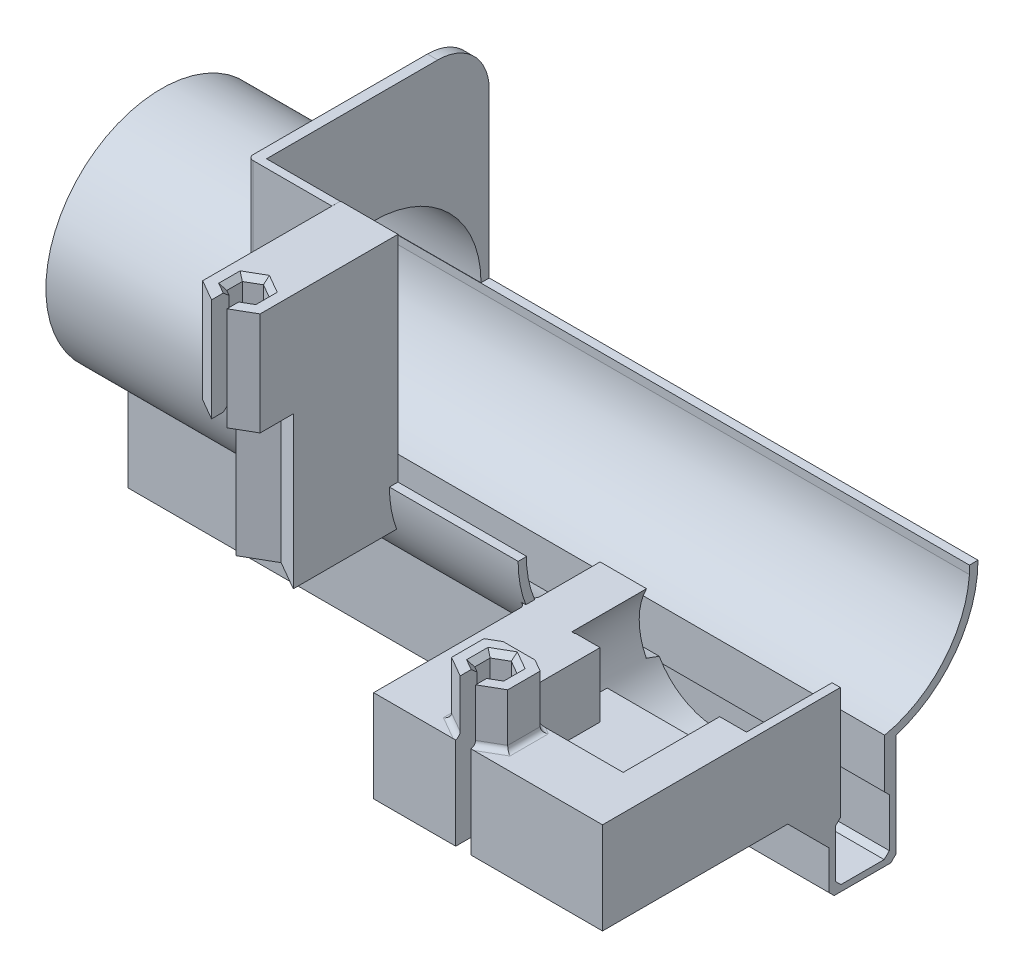
from build123d import *
from build123d.topology import SkipClean

# Parameters (mm, degrees)
SKETCH1_W            = 136
SKETCH1_H            = 13
BOSS_EXTRUDE1_DEPTH  = 21
CUT_EXTRUDE1_DEPTH   = 135
CHAMFER1_SIZE        = 1
CHAMFER2_SIZE        = 1
SKETCH6_W            = 135
SKETCH6_H            = 8.6
CUT_EXTRUDE3_DEPTH   = 9
SKETCH8_W            = 1.5
SKETCH8_H            = 7.54
CUT_EXTRUDE5_DEPTH   = 1
BOSS_EXTRUDE3_DEPTH  = 136
SKETCH11_R           = 22.4
SKETCH11_R_2         = 20.8
BOSS_EXTRUDE6_DEPTH  = 41.2
SKETCH6_5_W          = 135
SKETCH6_5_H          = 8.6
CUT_EXTRUDE11_DEPTH  = 35
SKETCH6_6_W          = 135
SKETCH6_6_H          = 8.6
CUT_EXTRUDE12_DEPTH  = 1
SKETCH13_W           = 47
SKETCH13_H           = 22
CUT_EXTRUDE13_DEPTH  = 32
BOSS_EXTRUDE7_DEPTH  = 22
BOSS_EXTRUDE8_DEPTH  = 4.79
BOSS_EXTRUDE10_DEPTH = 16.45
SKETCH18_R           = 13
CUT_EXTRUDE14_DEPTH  = 8
CUT_EXTRUDE15_START  = 8
SKETCH18_2_R         = 13
CUT_EXTRUDE15_DEPTH  = 8
SKETCH21_W           = 23.2
SKETCH21_H           = 25.13
CUT_EXTRUDE16_DEPTH  = 12.5
BOSS_EXTRUDE11_DEPTH = 1.39
SKETCH21_2_W         = 23.2
SKETCH21_2_H         = 25.13
CUT_EXTRUDE18_DEPTH  = 33.8
CUT_EXTRUDE20_DEPTH  = 12.5
SKETCH24_R           = 1.2
CUT_EXTRUDE21_DEPTH  = 12
CUT_EXTRUDE22_DEPTH  = 30
CUT_EXTRUDE23_START  = 8
SKETCH18_3_R         = 13
CUT_EXTRUDE23_DEPTH  = 8
CHAMFER3_SIZE        = 8
SKETCH26_W           = 12.499903438
SKETCH26_H           = 2.2
CUT_EXTRUDE24_DEPTH  = 8
CUT_EXTRUDE25_DEPTH  = 11
SKETCH28_W           = 1.6
SKETCH28_H           = 2.2
BOSS_EXTRUDE14_DEPTH = 12.5
CUT_EXTRUDE26_START  = -6.5
CUT_EXTRUDE26_DEPTH  = 6.5
FILLET2_R            = 1
FILLET3_R            = 1
BOSS_EXTRUDE15_DEPTH = 2.601750673
FILLET5_R            = 1
FILLET6_R            = 1
BOSS_EXTRUDE16_DEPTH = 20
BOSS_EXTRUDE17_DEPTH = 49.4
SKETCH36_W           = 11.15
SKETCH36_H           = 7.78
CUT_EXTRUDE27_DEPTH  = 20
BOSS_EXTRUDE18_START = -2
BOSS_EXTRUDE18_DEPTH = 2
FILLET10_R           = 10
SKETCH39_W           = 14.281750673
SKETCH39_H           = 1.6
BOSS_EXTRUDE19_DEPTH = 41.62
FILLET11_R           = 1
CUT_EXTRUDE28_DEPTH  = 25
CUT_EXTRUDE31_DEPTH  = 30
CHAMFER4_SIZE        = 1
CHAMFER5_SIZE        = 1


with BuildPart() as part:
    # Sketch1 → Boss-Extrude1 (new body)
    with BuildSketch(Plane(origin=(0, 0, 0), x_dir=(1, 0, 0), z_dir=(0, 1, 0))):
        with Locations((68, 6.5)):
            Rectangle(SKETCH1_W, SKETCH1_H)
    extrude(amount=BOSS_EXTRUDE1_DEPTH)

    # Sketch4 → Cut-Extrude1 (cut)
    with BuildSketch(Plane(origin=(136, 0, 0), x_dir=(0, 0, -1), z_dir=(1, 0, 0))):
        Polygon((1.3, 2.2), (2.3, 1.2), (10.7, 1.2), (11.7, 2.2), (11.7, 11.6), (10.7, 12.6), (2.3, 12.6), (1.3, 11.6), align=None)
    extrude(amount=-CUT_EXTRUDE1_DEPTH, mode=Mode.SUBTRACT)

    # Chamfer1
    chamfer1_edges = [part.edges().sort_by_distance(p)[0] for p in [
        (68, 0, 0),
    ]]
    chamfer(chamfer1_edges, length=CHAMFER1_SIZE)

    # Chamfer2
    chamfer2_edges = [part.edges().sort_by_distance(p)[0] for p in [
        (68, 0, -13),
    ]]
    chamfer(chamfer2_edges, length=CHAMFER2_SIZE)

    # Sketch6 → Cut-Extrude3 (cut)
    with BuildSketch(Plane(origin=(0, 21, 0), x_dir=(1, 0, 0), z_dir=(0, 1, 0))):
        with Locations((68.5, 6.5)):
            Rectangle(SKETCH6_W, SKETCH6_H)
    extrude(amount=-CUT_EXTRUDE3_DEPTH, mode=Mode.SUBTRACT)

    # Sketch8 → Cut-Extrude5 (cut)
    with BuildSketch(Plane.ZY):
        with Locations((-9.75, 16.23)):
            Rectangle(SKETCH8_W, SKETCH8_H)
        with Locations((-3.25, 16.23)):
            Rectangle(SKETCH8_W, SKETCH8_H)
    extrude(amount=-CUT_EXTRUDE5_DEPTH, mode=Mode.SUBTRACT)



with BuildPart() as body_2:
    # Sketch9 → Boss-Extrude3 (new body)
    with BuildSketch(Plane.ZY):
        with BuildLine():
            Line((-28.9, 42.4), (-27.238370235, 42.4))
            Line((-27.238370235, 42.4), (-27.238370235, 40.8))
            ThreePointArc((-27.238370235, 40.8), (-6.5, 21.6), (14.238370235, 40.8))
            Line((14.238370235, 40.8), (14.238370235, 42.4))
            Line((14.238370235, 42.4), (15.9, 42.4))
            ThreePointArc((15.9, 42.4), (-6.5, 20), (-28.9, 42.4))
        make_face()
    extrude(amount=-BOSS_EXTRUDE3_DEPTH)


with BuildPart() as part_1:
    add(part.part)

    add(body_2.part)  # Boss-Extrude6 merges body 2
    # Sketch11 → Boss-Extrude6 (add)
    with BuildSketch(Plane.ZY):
        with Locations((-6.5, 42.4)):
            Circle(SKETCH11_R)
        with Locations((-6.5, 42.4)):
            Circle(SKETCH11_R_2, mode=Mode.SUBTRACT)
    extrude(amount=-BOSS_EXTRUDE6_DEPTH)

    # Sketch6<5> → Cut-Extrude11 (cut)
    with BuildSketch(Plane(origin=(0, 21, 0), x_dir=(1, 0, 0), z_dir=(0, 1, 0))):
        with Locations((68.5, 6.5)):
            Rectangle(SKETCH6_5_W, SKETCH6_5_H)
    extrude(amount=CUT_EXTRUDE11_DEPTH, mode=Mode.SUBTRACT)

    # Sketch6<6> → Cut-Extrude12 (cut)
    with BuildSketch(Plane(origin=(0, 21, 0), x_dir=(1, 0, 0), z_dir=(0, 1, 0))):
        with Locations((68.5, 6.5)):
            Rectangle(SKETCH6_6_W, SKETCH6_6_H)
    extrude(amount=-CUT_EXTRUDE12_DEPTH, mode=Mode.SUBTRACT)

    # Sketch13 → Cut-Extrude13 (cut)
    with BuildSketch(Plane.XY):
        with Locations((112.5, 31.963815638)):
            Rectangle(SKETCH13_W, SKETCH13_H)
    extrude(amount=CUT_EXTRUDE13_DEPTH, mode=Mode.SUBTRACT)



with BuildPart() as body_2_2:
    # Sketch16 → Boss-Extrude7 (new body)
    with BuildSketch(Plane(origin=(0, 22.7, 0), x_dir=(1, 0, 0), z_dir=(0, 1, 0))):
        Polygon((109.021750673, -31.35), (103.574450883, -34.495), (103.574450883, -40.785), (109.021750673, -43.93), (114.469050463, -40.785), (114.469050463, -34.495), align=None)
        Polygon((109.021750673, -40.64), (111.619826884, -39.14), (111.619826884, -36.14), (109.021750673, -34.64), (106.423674461, -36.14), (106.423674461, -39.14), align=None, mode=Mode.SUBTRACT)
    extrude(amount=BOSS_EXTRUDE7_DEPTH)

    # Sketch16<2> → Boss-Extrude8 (add)
    with BuildSketch(Plane(origin=(0, 22.7, 0), x_dir=(1, 0, 0), z_dir=(0, 1, 0))):
        Polygon((109.021750673, -31.35), (103.574450883, -34.495), (103.574450883, -40.785), (109.021750673, -43.93), (114.469050463, -40.785), (114.469050463, -34.495), align=None)
        Polygon((109.021750673, -40.64), (111.619826884, -39.14), (111.619826884, -36.14), (109.021750673, -34.64), (106.423674461, -36.14), (106.423674461, -39.14), align=None, mode=Mode.SUBTRACT)
    extrude(amount=-BOSS_EXTRUDE8_DEPTH)


with BuildPart() as part_2:
    add(part_1.part)

    add(body_2_2.part)  # Boss-Extrude10 merges body 2 2
    # Sketch17 → Boss-Extrude10 (add)
    with BuildSketch(Plane.XZ.offset(-17.91)):
        Polygon((94.021750673, 43.93), (136, 43.93), (136, 0), (94.021750673, 0), (91.601750673, 0), (91.601750673, 43.93), align=None)
    extrude(amount=-BOSS_EXTRUDE10_DEPTH)

    # Sketch18 → Cut-Extrude14 (cut)
    with BuildSketch(Plane.XY):
        with Locations((112.185002614, 28.45)):
            Circle(SKETCH18_R)
    extrude(amount=-CUT_EXTRUDE14_DEPTH, mode=Mode.SUBTRACT)

    # Sketch18<2> → Cut-Extrude15 (cut)
    with BuildSketch(Plane.XY.offset(CUT_EXTRUDE15_START)):
        with Locations((112.185002614, 28.45)):
            Circle(SKETCH18_2_R)
    extrude(amount=-CUT_EXTRUDE15_DEPTH, mode=Mode.SUBTRACT)

    # Sketch21 → Cut-Extrude16 (cut)
    with BuildSketch(Plane(origin=(0, 34.36, 0), x_dir=(1, 0, 0), z_dir=(0, 1, 0))):
        with Locations((117.6, -20.565)):
            Rectangle(SKETCH21_W, SKETCH21_H)
    extrude(amount=-CUT_EXTRUDE16_DEPTH, mode=Mode.SUBTRACT)

    # Sketch17<3> → Boss-Extrude11 (add)
    with BuildSketch(Plane.XZ.offset(-17.91)):
        Polygon((94.021750673, 43.93), (136, 43.93), (136, 0), (94.021750673, 0), (91.601750673, 0), (91.601750673, 43.93), align=None)
    extrude(amount=BOSS_EXTRUDE11_DEPTH)

    # Sketch21<2> → Cut-Extrude18 (cut)
    with BuildSketch(Plane(origin=(0, 34.36, 0), x_dir=(1, 0, 0), z_dir=(0, 1, 0))):
        with Locations((117.6, -20.565)):
            Rectangle(SKETCH21_2_W, SKETCH21_2_H)
    extrude(amount=CUT_EXTRUDE18_DEPTH, mode=Mode.SUBTRACT)

    # Sketch23 → Cut-Extrude20 (cut)
    with BuildSketch(Plane(origin=(0, 34.36, 0), x_dir=(1, 0, 0), z_dir=(0, 1, 0))):
        Polygon((101.2, -8), (123.763944708, -8), (123.763944708, 0.5), (134.4, 0.5), (134.4, -8), (134.4, -14.4), (101.2, -14.4), align=None)
    extrude(amount=-CUT_EXTRUDE20_DEPTH, mode=Mode.SUBTRACT)

    # Sketch24 → Cut-Extrude21 (cut)
    with BuildSketch(Plane(origin=(0, 0, 14.4), x_dir=(-1, 0, 0), z_dir=(0, 0, -1))):
        with Locations((-131.31, 28.41)):
            Circle(SKETCH24_R)
        with Locations((-103.81, 28.41)):
            Circle(SKETCH24_R)
    extrude(amount=-CUT_EXTRUDE21_DEPTH, mode=Mode.SUBTRACT)

    # Sketch25 → Cut-Extrude22 (cut)
    with BuildSketch(Plane.XZ.offset(-16.52)):
        Polygon((109.021750673, 34.64), (111.619826884, 36.14), (111.619826884, 39.14), (109.021750673, 40.64), (106.423674461, 39.14), (106.423674461, 36.14), align=None)
    extrude(amount=-CUT_EXTRUDE22_DEPTH, mode=Mode.SUBTRACT)

    # Sketch18<3> → Cut-Extrude23 (cut)
    with BuildSketch(Plane.XY.offset(CUT_EXTRUDE23_START)):
        with Locations((112.185002614, 28.45)):
            Circle(SKETCH18_3_R)
    extrude(amount=-CUT_EXTRUDE23_DEPTH, mode=Mode.SUBTRACT)

    # Chamfer3
    # the kernel refuses this chamfer: 8, 6.0837234 mm, written as the material it adds along each edge
    with BuildSketch(Plane(origin=(127.593672234, 16.52, 0), x_dir=(0, 0, 1), z_dir=(-1, 0, 0))) as chamfer3_piece_1_section:
        Polygon((CHAMFER3_SIZE, 0), (0, -CHAMFER3_SIZE), (0, 0), align=None)
    chamfer3_piece_1 = extrude(amount=35.991921561, mode=Mode.PRIVATE)
    chamfer3_piece_1 = chamfer3_piece_1 - Plane(origin=(112.185002614, 28.45, 0), x_dir=(1, 0, 0), z_dir=(0, 0, 1)) * Cylinder(13, 104, mode=Mode.PRIVATE)
    add(chamfer3_piece_1)
    with BuildSketch(Plane(origin=(136, 16.52, 0), x_dir=(0, 0, 1), z_dir=(-1, 0, 0))) as chamfer3_piece_2_section:
        Polygon((CHAMFER3_SIZE, 0), (0, -CHAMFER3_SIZE), (0, 0), align=None)
    chamfer3_piece_2 = extrude(amount=39.223667005, mode=Mode.PRIVATE)
    chamfer3_piece_2 = chamfer3_piece_2 - Plane(origin=(112.185002614, 28.45, 0), x_dir=(1, 0, 0), z_dir=(0, 0, 1)) * Cylinder(13, 111, mode=Mode.PRIVATE)
    add(chamfer3_piece_2)

    # Sketch26 → Cut-Extrude24 (cut)
    with BuildSketch(Plane(origin=(0, 21.86, 0), x_dir=(1, 0, 0), z_dir=(0, 1, 0))):
        with Locations((129.750048281, 1.1)):
            Rectangle(SKETCH26_W, SKETCH26_H)
    extrude(amount=CUT_EXTRUDE24_DEPTH, mode=Mode.SUBTRACT)

    # Sketch27 → Cut-Extrude25 (cut)
    with BuildSketch(Plane.XY.offset(8)):
        Polygon((123.763944708, 21.86), (123.763944708, 22.54), (123.39088946, 21.86), align=None)
    extrude(amount=-CUT_EXTRUDE25_DEPTH, mode=Mode.SUBTRACT)

    # Sketch28 → Boss-Extrude14 (add)
    with BuildSketch(Plane(origin=(0, 21.86, 0), x_dir=(1, 0, 0), z_dir=(0, 1, 0))):
        with Locations((135.2, 1.1)):
            Rectangle(SKETCH28_W, SKETCH28_H)
    extrude(amount=BOSS_EXTRUDE14_DEPTH)

    # Sketch29 → Cut-Extrude26 (cut)
    with SkipClean():  # the faces are left unmerged after this step: merging them gives an invalid solid
        with BuildSketch(Plane(origin=(0, 0, 8), x_dir=(-1, 0, 0), z_dir=(0, 0, -1)).offset(CUT_EXTRUDE26_START)):
            with BuildLine():
                Line((-101.2, 34.36), (-101.2, 21.86))
                Line((-101.2, 21.86), (-100.554707079, 22.6417106))
                ThreePointArc((-100.554707079, 22.6417106), (-99.185127444, 28.506969778), (-100.606060521, 34.36))
                Line((-100.606060521, 34.36), (-101.2, 34.36))
            make_face()
            with BuildLine():
                Line((-100.554707079, 22.6417106), (-101.2, 21.86))
                Line((-101.2, 21.86), (-100.979115769, 21.86))
                ThreePointArc((-100.979115769, 21.86), (-100.760223653, 22.247224356), (-100.554707079, 22.6417106))
            make_face()
        extrude(amount=CUT_EXTRUDE26_DEPTH, mode=Mode.SUBTRACT)

    # Fillet2
    # the kernel refuses this fillet: 1 mm, written as the material it adds along each edge
    with BuildSketch(Plane(origin=(114.469050463, 34.36, 43.285), x_dir=(1, 0, 0), z_dir=(0, 0, -1))) as fillet2_piece_1_section:
        with BuildLine():
            CenterArc((FILLET2_R, -FILLET2_R), FILLET2_R, 90, 90)
            Line((0, -FILLET2_R), (0, 0))
            Line((0, 0), (FILLET2_R, 0))
        make_face()
    fillet2_piece_1 = extrude(amount=11.29, mode=Mode.PRIVATE)
    fillet2_piece_1 = split(fillet2_piece_1, bisect_by=Plane(origin=(118.275232112, 34.36, 36.6925), z_dir=(-0.5000000000000013, 0, 0.8660254037844379)), keep=Keep.TOP, mode=Mode.PRIVATE)
    fillet2_piece_1 = split(fillet2_piece_1, bisect_by=Plane(origin=(113.386518708, 34.36, 41.41), z_dir=(-0.5000000000000012, 0, -0.866025403784438)), keep=Keep.TOP, mode=Mode.PRIVATE)
    add(fillet2_piece_1)
    with BuildSketch(Plane(origin=(116.634113972, 34.36, 35.745), x_dir=(0.5000000000000013, 0, -0.8660254037844379), z_dir=(-0.8660254037844379, 0, -0.5000000000000013))) as fillet2_piece_2_section:
        with BuildLine():
            CenterArc((FILLET2_R, -FILLET2_R), FILLET2_R, 90, 90)
            Line((0, -FILLET2_R), (0, 0))
            Line((0, 0), (FILLET2_R, 0))
        make_face()
    fillet2_piece_2 = extrude(amount=7.73, mode=Mode.PRIVATE)
    fillet2_piece_2 = split(fillet2_piece_2, bisect_by=Plane(origin=(116.634113972, 34.36, 33.13), z_dir=(0, 0, 1)), keep=Keep.TOP, mode=Mode.PRIVATE)
    fillet2_piece_2 = split(fillet2_piece_2, bisect_by=Plane(origin=(114.469050463, 34.36, 35.745), z_dir=(-1, 0, 0)), keep=Keep.TOP, mode=Mode.PRIVATE)
    add(fillet2_piece_2)
    with BuildSketch(Plane(origin=(106.856687163, 34.36, 45.18), x_dir=(0.5000000000000012, 0, 0.8660254037844379), z_dir=(0.866025403784438, 0, -0.5000000000000012))) as fillet2_piece_3_section:
        with BuildLine():
            CenterArc((FILLET2_R, -FILLET2_R), FILLET2_R, 90, 90)
            Line((0, -FILLET2_R), (0, 0))
            Line((0, 0), (FILLET2_R, 0))
        make_face()
    fillet2_piece_3 = extrude(amount=11.29, mode=Mode.PRIVATE)
    fillet2_piece_3 = split(fillet2_piece_3, bisect_by=Plane(origin=(106.856687163, 34.36, 43.93), z_dir=(0, 0, -1)), keep=Keep.TOP, mode=Mode.PRIVATE)
    fillet2_piece_3 = split(fillet2_piece_3, bisect_by=Plane(origin=(107.939218918, 34.36, 43.305), z_dir=(0.4999999999999987, 0, -0.8660254037844394)), keep=Keep.TOP, mode=Mode.PRIVATE)
    fillet2_piece_3 = split(fillet2_piece_3, bisect_by=Plane(origin=(114.469050463, 34.36, 45.18), z_dir=(-1, 0, 0)), keep=Keep.TOP, mode=Mode.PRIVATE)
    add(fillet2_piece_3)
    with BuildSketch(Plane(origin=(114.469050463, 34.36, 43.285), x_dir=(1, 0, 0), z_dir=(0, 0, -1))) as fillet2_piece_4a_section:
        with BuildLine():
            CenterArc((FILLET2_R, -FILLET2_R), FILLET2_R, 90, 90)
            Line((0, -FILLET2_R), (0, 0))
            Line((0, 0), (FILLET2_R, 0))
        make_face()
    fillet2_piece_4a = extrude(amount=11.29, mode=Mode.PRIVATE)
    fillet2_piece_4a = split(fillet2_piece_4a, bisect_by=Plane(origin=(113.386518708, 34.36, 41.41), z_dir=(0.5000000000000012, 0, 0.866025403784438)), keep=Keep.TOP, mode=Mode.PRIVATE)
    with BuildSketch(Plane(origin=(106.856687163, 34.36, 45.18), x_dir=(0.5000000000000012, 0, 0.8660254037844379), z_dir=(0.866025403784438, 0, -0.5000000000000012))) as fillet2_piece_4b_section:
        with BuildLine():
            CenterArc((FILLET2_R, -FILLET2_R), FILLET2_R, 90, 90)
            Line((0, -FILLET2_R), (0, 0))
            Line((0, 0), (FILLET2_R, 0))
        make_face()
    fillet2_piece_4b = extrude(amount=11.29, mode=Mode.PRIVATE)
    fillet2_piece_4b = split(fillet2_piece_4b, bisect_by=Plane(origin=(114.469050463, 34.36, 45.18), z_dir=(1, 0, 0)), keep=Keep.TOP, mode=Mode.PRIVATE)
    fillet2_piece_4 = fillet2_piece_4a & fillet2_piece_4b
    add(fillet2_piece_4)
    with BuildSketch(Plane(origin=(116.634113972, 34.36, 35.745), x_dir=(0.5000000000000013, 0, -0.8660254037844379), z_dir=(-0.8660254037844379, 0, -0.5000000000000013))) as fillet2_piece_5a_section:
        with BuildLine():
            CenterArc((FILLET2_R, -FILLET2_R), FILLET2_R, 90, 90)
            Line((0, -FILLET2_R), (0, 0))
            Line((0, 0), (FILLET2_R, 0))
        make_face()
    fillet2_piece_5a = extrude(amount=7.73, mode=Mode.PRIVATE)
    fillet2_piece_5a = split(fillet2_piece_5a, bisect_by=Plane(origin=(114.469050463, 34.36, 35.745), z_dir=(1, 0, 0)), keep=Keep.TOP, mode=Mode.PRIVATE)
    with BuildSketch(Plane(origin=(114.469050463, 34.36, 43.285), x_dir=(1, 0, 0), z_dir=(0, 0, -1))) as fillet2_piece_5b_section:
        with BuildLine():
            CenterArc((FILLET2_R, -FILLET2_R), FILLET2_R, 90, 90)
            Line((0, -FILLET2_R), (0, 0))
            Line((0, 0), (FILLET2_R, 0))
        make_face()
    fillet2_piece_5b = extrude(amount=11.29, mode=Mode.PRIVATE)
    fillet2_piece_5b = split(fillet2_piece_5b, bisect_by=Plane(origin=(114.469050463, 34.36, 33.13), z_dir=(0, 0, 1)), keep=Keep.TOP, mode=Mode.PRIVATE)
    fillet2_piece_5b = split(fillet2_piece_5b, bisect_by=Plane(origin=(118.275232112, 34.36, 36.6925), z_dir=(0.5000000000000013, 0, -0.8660254037844379)), keep=Keep.TOP, mode=Mode.PRIVATE)
    fillet2_piece_5 = fillet2_piece_5a & fillet2_piece_5b
    add(fillet2_piece_5)

    # Fillet3
    fillet3_edges = [part_2.edges().sort_by_distance(p)[0] for p in [
        (104.787225441, 34.36, 33.794804282),
        (103.574450883, 34.36, 37.64),
        (106.298100778, 34.36, 42.3575),
    ]]
    fillet(fillet3_edges, radius=FILLET3_R)

    # Sketch30 → Boss-Extrude15 (add)
    with BuildSketch(Plane(origin=(89, 0, 0), x_dir=(0, 0, -1), z_dir=(1, 0, 0))):
        with BuildLine():
            Line((-14.238370235, 40.8), (-14.238370235, 42.4))
            Line((-14.238370235, 42.4), (-15.9, 42.4))
            ThreePointArc((-15.9, 42.4), (-11.491108915, 29.055338146), (0, 20.963815638))
            Line((0, 20.963815638), (0, 22.6417106))
            ThreePointArc((0, 22.6417106), (-9.868050334, 29.565401126), (-14.238370235, 40.8))
        make_face()
    extrude(amount=BOSS_EXTRUDE15_DEPTH)

    # Fillet5
    # the kernel refuses this fillet: 1 mm, written as the material it adds along each edge
    with BuildSketch(Plane(origin=(91.601750673, 42.4, -6.5), x_dir=(0, -0.980537212362055, 0.19633332670041045), z_dir=(0, -0.19633332670041045, -0.980537212362055))) as fillet5_piece_1_section:
        with BuildLine():
            CenterArc((20.8 - FILLET5_R, FILLET5_R), FILLET5_R, 270, 90)
            Line((20.8, FILLET5_R), (20.8, 0))
            Line((20.8, 0), (20.8 - FILLET5_R, FILLET5_R * 2.94008373203e-10))
        make_face()
    fillet5_piece_1 = revolve(axis=Axis((91.601750673, 42.4, -6.5), (-1, 0, 0)), revolution_arc=62.825427053, mode=Mode.PRIVATE)
    fillet5_piece_1 = split(fillet5_piece_1, bisect_by=Plane(origin=(91.601750673, 34.36, -6.5), z_dir=(0, -1, 0)), keep=Keep.TOP, mode=Mode.PRIVATE)
    fillet5_piece_1 = split(fillet5_piece_1, bisect_by=Plane(origin=(91.601750673, 42.4, 0), z_dir=(0, 0, 1)), keep=Keep.TOP, mode=Mode.PRIVATE)
    add(fillet5_piece_1)

    # Fillet6
    fillet6_edges = [part_2.edges().sort_by_distance(p)[0] for p in [
        (91.601750673, 25.995595503, 8.753049305),
    ]]
    fillet(fillet6_edges, radius=FILLET6_R)

    # Sketch36 → Cut-Extrude27 (cut)
    with BuildSketch(Plane(origin=(0, 0, 14.238370235), x_dir=(-1, 0, 0), z_dir=(0, 0, -1))):
        with Locations((-61.056750673, 38.51)):
            Rectangle(SKETCH36_W, SKETCH36_H)
    extrude(amount=-CUT_EXTRUDE27_DEPTH, mode=Mode.SUBTRACT)

    # Sketch37 → Boss-Extrude18 (add)
    with BuildSketch(Plane(origin=(41.2, 0, 0), x_dir=(0, 0, -1), z_dir=(1, 0, 0)).offset(BOSS_EXTRUDE18_START)):
        with BuildLine():
            Line((-15.9, 42.4), (-15.9, 84.02))
            Line((-15.9, 84.02), (28.9, 84.02))
            Line((28.9, 84.02), (28.9, 42.4))
            ThreePointArc((28.9, 42.4), (6.5, 64.8), (-15.9, 42.4))
        make_face()
    extrude(amount=BOSS_EXTRUDE18_DEPTH)

    # Fillet10
    fillet10_edges = [part_2.edges().sort_by_distance(p)[0] for p in [
        (40.2, 84.02, -28.9),
    ]]
    fillet(fillet10_edges, radius=FILLET10_R)

    # Sketch39 → Boss-Extrude19 (add)
    with BuildSketch(Plane(origin=(0, 42.4, 0), x_dir=(1, 0, 0), z_dir=(0, 1, 0))):
        with Locations((48.340875337, -15.1)):
            Rectangle(SKETCH39_W, SKETCH39_H)
    extrude(amount=BOSS_EXTRUDE19_DEPTH)

    # Fillet11
    # the kernel refuses this fillet: 1 mm, written as the material it takes off along each edge
    with BuildSketch(Plane(origin=(39.2, 34.9, 15.9), x_dir=(0, 0, -1), z_dir=(0, 1, 0))) as fillet11_piece_1_section:
        with BuildLine():
            CenterArc((FILLET11_R, -FILLET11_R), FILLET11_R, 90, 90)
            Line((0, -FILLET11_R), (0, 0))
            Line((0, 0), (FILLET11_R, 0))
        make_face()
    fillet11_piece_1 = extrude(amount=51.62, mode=Mode.PRIVATE)
    fillet11_piece_1 = fillet11_piece_1 - Plane(origin=(39.2, 42.4, -6.5), x_dir=(0, 0, 1), z_dir=(-1, 0, 0)) * Cylinder(22.4, 108, mode=Mode.PRIVATE)
    add(fillet11_piece_1, mode=Mode.SUBTRACT)

    # Sketch41 → Cut-Extrude31 (cut)
    with BuildSketch(Plane(origin=(0, 44.7, 0), x_dir=(1, 0, 0), z_dir=(0, 1, 0))):
        Polygon((107.521750673, -39.773974596), (107.521750673, -43.063974596), (107.521750673, -44.703780199), (110.521750673, -44.703780199), (110.521750673, -43.063974596), (110.521750673, -39.773974596), (109.021750673, -40.64), align=None)
    extrude(amount=-CUT_EXTRUDE31_DEPTH, mode=Mode.SUBTRACT)

    # Chamfer5
    chamfer5_edges = [part_2.edges().sort_by_distance(p)[0] for p in [
        (106.972712567, 44.7, 39.456987298),
        (111.619826884, 44.7, 37.64),
        (110.320788778, 44.7, 35.39),
        (107.722712567, 44.7, 35.39),
        (106.423674461, 44.7, 37.64),
        (107.722712567, 16.52, 35.39),
        (110.320788778, 16.52, 35.39),
        (111.619826884, 16.52, 37.64),
        (111.070788778, 16.52, 39.456987298),
        (106.423674461, 16.52, 37.64),
        (111.070788778, 44.7, 39.456987298),
        (106.972712567, 16.52, 39.456987298),
    ]]
    chamfer(chamfer5_edges, length=CHAMFER5_SIZE)


with BuildPart() as body_2_3:
    # Sketch31 → Boss-Extrude16 (new body)
    with BuildSketch(Plane(origin=(0, 64.02, 0), x_dir=(1, 0, 0), z_dir=(0, 1, 0))):
        Polygon((61.061750673, -31.325), (55.488877199, -34.5425), (55.488877199, -40.9775), (61.061750673, -44.195), (66.634624146, -40.9775), (66.634624146, -34.5425), align=None)
        Polygon((61.061750673, -40.76), (63.659826884, -39.26), (63.659826884, -36.26), (61.061750673, -34.76), (58.463674461, -36.26), (58.463674461, -39.26), align=None, mode=Mode.SUBTRACT)
    extrude(amount=BOSS_EXTRUDE16_DEPTH)

    # Sketch32 → Boss-Extrude17 (add)
    with BuildSketch(Plane(origin=(0, 84.02, 0), x_dir=(1, 0, 0), z_dir=(0, 1, 0))):
        Polygon((66.634624146, -34.5425), (66.634624146, -14.238370235), (55.488877199, -14.238370235), (55.488877199, -34.5425), (61.061750673, -31.325), align=None)
    extrude(amount=-BOSS_EXTRUDE17_DEPTH)

    # Sketch40 → Cut-Extrude28 (cut)
    with BuildSketch(Plane(origin=(0, 84.02, 0), x_dir=(1, 0, 0), z_dir=(0, 1, 0))):
        Polygon((59.561750673, -39.893974596), (59.561750673, -43.328974596), (61.061750673, -44.195), (62.561750673, -43.328974596), (62.561750673, -39.893974596), (61.061750673, -40.76), align=None)
    extrude(amount=-CUT_EXTRUDE28_DEPTH, mode=Mode.SUBTRACT)

    # Chamfer4
    chamfer4_edges = [body_2_3.edges().sort_by_distance(p)[0] for p in [
        (59.012712567, 64.02, 39.576987298),
        (63.659826884, 64.02, 37.76),
        (62.360788778, 64.02, 35.51),
        (59.762712567, 64.02, 35.51),
        (58.463674461, 64.02, 37.76),
        (59.012712567, 84.02, 39.576987298),
        (63.659826884, 84.02, 37.76),
        (62.360788778, 84.02, 35.51),
        (59.762712567, 84.02, 35.51),
        (58.463674461, 84.02, 37.76),
        (63.110788778, 64.02, 39.576987298),
        (63.110788778, 84.02, 39.576987298),
    ]]
    chamfer(chamfer4_edges, length=CHAMFER4_SIZE)


solid = Compound([part_2.part, body_2_3.part])
